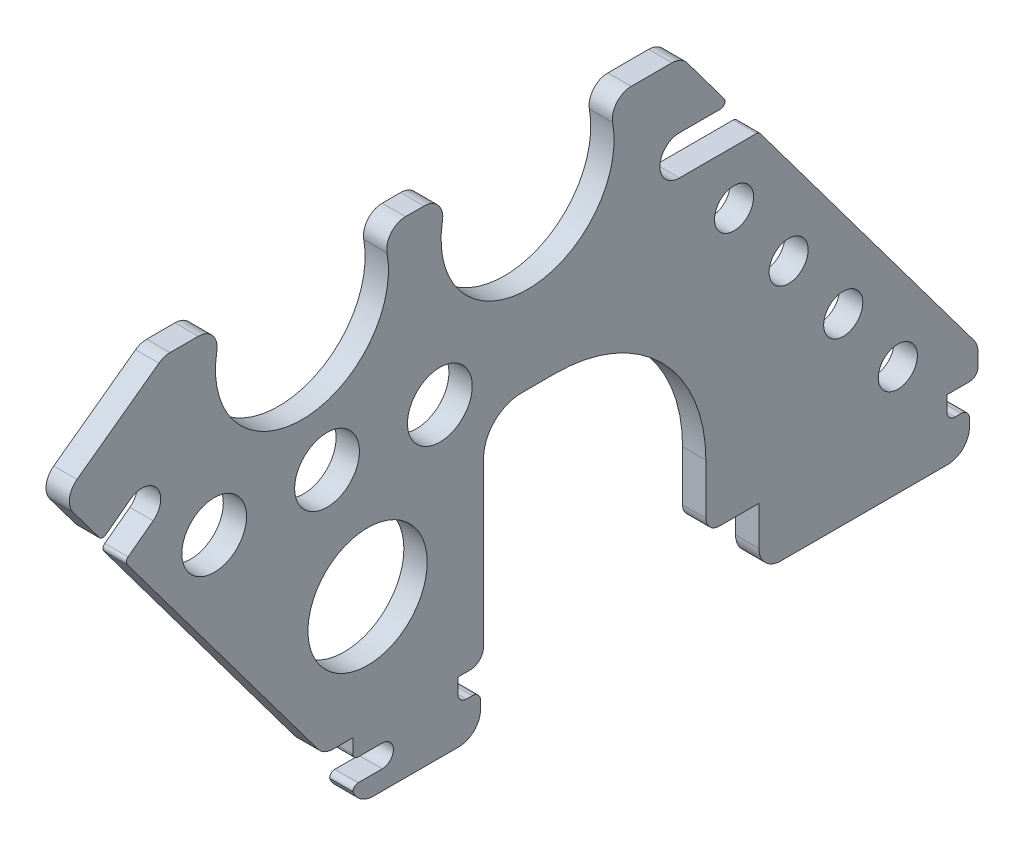
from build123d import *

# Parameters (mm, degrees)
BOSS_EXTRUDE1_DEPTH = 3.1
FILLET1_R           = 2.5
FILLET2_R           = 1.1
SKETCH2_R           = 4.304443881
SKETCH2_R_2         = 7.925342076
SKETCH2_W           = 29.557408324
SKETCH2_H           = 28.485114527
CUT_EXTRUDE1_DEPTH  = 4
FILLET3_R           = 0.7
FILLET4_R           = 1.1
FILLET5_R           = 2.9
FILLET6_R           = 20
FILLET7_R           = 5
FILLET8_R           = 1.8
SKETCH4_R           = 2.6
CUT_EXTRUDE2_DEPTH  = 130.682927753
FILLET9_R           = 0.6


with BuildPart() as part:
    # Sketch1 → Boss-Extrude1 (new body)
    with BuildSketch(Plane(origin=(0, 0, 0), x_dir=(0, 0, -1), z_dir=(1, 0, 0))):
        with BuildLine():
            Line((0, 0), (0, -3.1))
            Line((0, -3.1), (3, -3.1))
            Line((3, -3.1), (3, -8.1))
            Line((3, -8.1), (-25, -8.1))
            Line((-25, -8.1), (-25, 0))
            Line((-25, 0), (-65, 0))
            Line((-65, 0), (-65, -3.1))
            Line((-65, -3.1), (-62, -3.1))
            Line((-62, -3.1), (-62, -8.1))
            Line((-62, -8.1), (-78.979671767, -8.1))
            Line((-78.979671767, -8.1), (-78.979671767, 0))
            Line((-78.979671767, 0), (-82.880201339, 0))
            Line((-82.880201339, 0), (-117.70382886, 46.590063892))
            Line((-117.70382886, 46.590063892), (-104.111751507, 56.5))
            Line((-104.111751507, 56.5), (-96.111751507, 56.5))
            ThreePointArc((-96.111751507, 56.5), (-85.755593918, 40), (-75.39943633, 56.5))
            Line((-75.39943633, 56.5), (-66.111751507, 56.5))
            ThreePointArc((-66.111751507, 56.5), (-55.755593918, 40), (-45.39943633, 56.5))
            Line((-45.39943633, 56.5), (-35.299167427, 56.5))
            Line((-35.299167427, 56.5), (4.130048311, 3.748181445))
            Line((4.130048311, 3.748181445), (4.130048311, 0))
            Line((4.130048311, 0), (0, 0))
        make_face()
    extrude(amount=BOSS_EXTRUDE1_DEPTH)

    # Fillet1
    fillet1_edges = [part.edges().sort_by_distance(p)[0] for p in [
        (1.55, 0, 82.880201339),
        (1.55, 46.590063892, 117.70382886),
        (1.55, 56.5, 104.111751507),
        (1.55, 56.5, 96.111751507),
        (1.55, 56.5, 75.39943633),
        (1.55, 56.5, 66.111751507),
        (1.55, 56.5, 45.39943633),
        (1.55, 56.5, 35.299167427),
        (1.55, 3.748181445, -4.130048311),
    ]]
    fillet(fillet1_edges, radius=FILLET1_R)

    # Fillet2
    fillet2_edges = [part.edges().sort_by_distance(p)[0] for p in [
        (1.55, 0, -4.130048311),
    ]]
    fillet(fillet2_edges, radius=FILLET2_R)

    # Sketch2 → Cut-Extrude1 (cut)
    with BuildSketch(Plane(origin=(3.1, 0, 0), x_dir=(0, 0, -1), z_dir=(1, 0, 0))):
        with Locations((-97.418386441, 32.55612307)):
            Circle(SKETCH2_R)
        with Locations((-77.029808816, 15.272951492)):
            Circle(SKETCH2_R_2)
        with Locations((-82.418386441, 32.55612307)):
            Circle(SKETCH2_R)
        with Locations((-67.418386441, 32.55612307)):
            Circle(SKETCH2_R)
        with BuildLine():
            Line((-78.979671767, -2.567225462), (-75.079945866, -2.567225462))
            ThreePointArc((-75.079945866, -2.567225462), (-73.597171327, -4.05), (-75.079945866, -5.532774538))
            Line((-75.079945866, -5.532774538), (-78.979671767, -5.532774538))
            ThreePointArc((-78.979671767, -5.532774538), (-80.462446305, -4.05), (-78.979671767, -2.567225462))
        make_face()
        with Locations((-46.829052789, 14.242557264)):
            Rectangle(SKETCH2_W, SKETCH2_H)
    extrude(amount=-CUT_EXTRUDE1_DEPTH, mode=Mode.SUBTRACT)

    # Fillet3
    fillet3_edges = [part.edges().sort_by_distance(p)[0] for p in [
        (1.55, -2.567225462, 78.979671767),
        (1.55, -5.532774538, 78.979671767),
    ]]
    fillet(fillet3_edges, radius=FILLET3_R)

    # Fillet4
    fillet4_edges = [part.edges().sort_by_distance(p)[0] for p in [
        (1.55, -3.1, 0),
        (1.55, -3.1, -3),
        (1.55, -3.1, 65),
        (1.55, -3.1, 62),
    ]]
    fillet(fillet4_edges, radius=FILLET4_R)

    # Fillet5
    # the kernel refuses this fillet: 2.9 mm, written as the material it takes off along each edge
    with BuildSketch(Plane(origin=(-7.25, -8.1, -3), x_dir=(0, 0, 1), z_dir=(1, 0, 0)), Plane(origin=(-7.25, -8.1, 25), x_dir=(0, 1, 0), z_dir=(1, 0, 0))) as fillet5_piece_1:
        with BuildLine():
            CenterArc((FILLET5_R, -FILLET5_R), FILLET5_R, 90, 90)
            Line((0, -FILLET5_R), (0, 0))
            Line((0, 0), (FILLET5_R, 0))
        make_face()
    extrude(amount=17.6, mode=Mode.SUBTRACT)
    with BuildSketch(Plane(origin=(-7.25, -8.1, 62), x_dir=(0, 1, 0), z_dir=(1, 0, 0))) as fillet5_piece_2:
        with BuildLine():
            CenterArc((FILLET5_R, FILLET5_R), FILLET5_R, 180, 90)
            Line((0, FILLET5_R), (0, 0))
            Line((0, 0), (FILLET5_R, 0))
        make_face()
    extrude(amount=17.6, mode=Mode.SUBTRACT)
    with BuildSketch(Plane(origin=(-6.774666391, -8.1, 78.979671767), x_dir=(0, 0, -1), z_dir=(1, 0, 0))) as fillet5_piece_3:
        with BuildLine():
            CenterArc((2.709866556, 2.9), FILLET5_R, 200.862663323, 69.137336677)
            Line((0, 1.867225462), (0, 0))
            Line((0, 0), (2.709866556, 0))
        make_face()
    extrude(amount=16.649332781, mode=Mode.SUBTRACT)

    # Fillet6
    fillet6_edges = [part.edges().sort_by_distance(p)[0] for p in [
        (1.55, 28.485114527, 32.050348627),
    ]]
    fillet(fillet6_edges, radius=FILLET6_R)

    # Fillet7
    fillet7_edges = [part.edges().sort_by_distance(p)[0] for p in [
        (1.55, 28.485114527, 61.607756951),
    ]]
    fillet(fillet7_edges, radius=FILLET7_R)

    # Fillet8
    fillet8_edges = [part.edges().sort_by_distance(p)[0] for p in [
        (1.55, 0, 61.607756951),
        (1.55, 0, 32.050348627),
    ]]
    fillet(fillet8_edges, radius=FILLET8_R)

    # Sketch4 → Cut-Extrude2 (cut, through all)
    with BuildSketch(Plane(origin=(3.1, 0, 0), x_dir=(0, 0, -1), z_dir=(1, 0, 0))):
        with Locations((-28.303725911, 35.631276326)):
            Circle(SKETCH4_R)
        with Locations((-21.045298439, 25.920323627)):
            Circle(SKETCH4_R)
        with Locations((-13.786870968, 16.209370928)):
            Circle(SKETCH4_R)
        with Locations((-6.528443496, 6.498418229)):
            Circle(SKETCH4_R)
        with BuildLine():
            Line((-35.562153383, 47.942229025), (-28.90268277, 47.942229025))
            Line((-28.90268277, 47.942229025), (-25.015955687, 42.742229025))
            Line((-25.015955687, 42.742229025), (-35.562153383, 42.742229025))
            ThreePointArc((-35.562153383, 42.742229025), (-38.162153383, 45.342229025), (-35.562153383, 47.942229025))
        make_face()
        with BuildLine():
            Line((-112.340464073, 39.414490126), (-108.529774826, 42.262780338))
            ThreePointArc((-108.529774826, 42.262780338), (-105.030597304, 41.757056436), (-105.536321205, 38.257878913))
            Line((-105.536321205, 38.257878913), (-109.347010452, 35.409588702))
            ThreePointArc((-109.347010452, 35.409588702), (-112.846187975, 35.915312603), (-112.340464073, 39.414490126))
        make_face()
    extrude(amount=-CUT_EXTRUDE2_DEPTH, mode=Mode.SUBTRACT)

    # Fillet9
    fillet9_edges = [part.edges().sort_by_distance(p)[0] for p in [
        (1.55, 47.942229025, 28.90268277),
        (1.55, 42.742229025, 25.015955687),
        (1.55, 35.409588702, 109.347010452),
        (1.55, 39.414490126, 112.340464073),
    ]]
    fillet(fillet9_edges, radius=FILLET9_R)


solid = part.part
